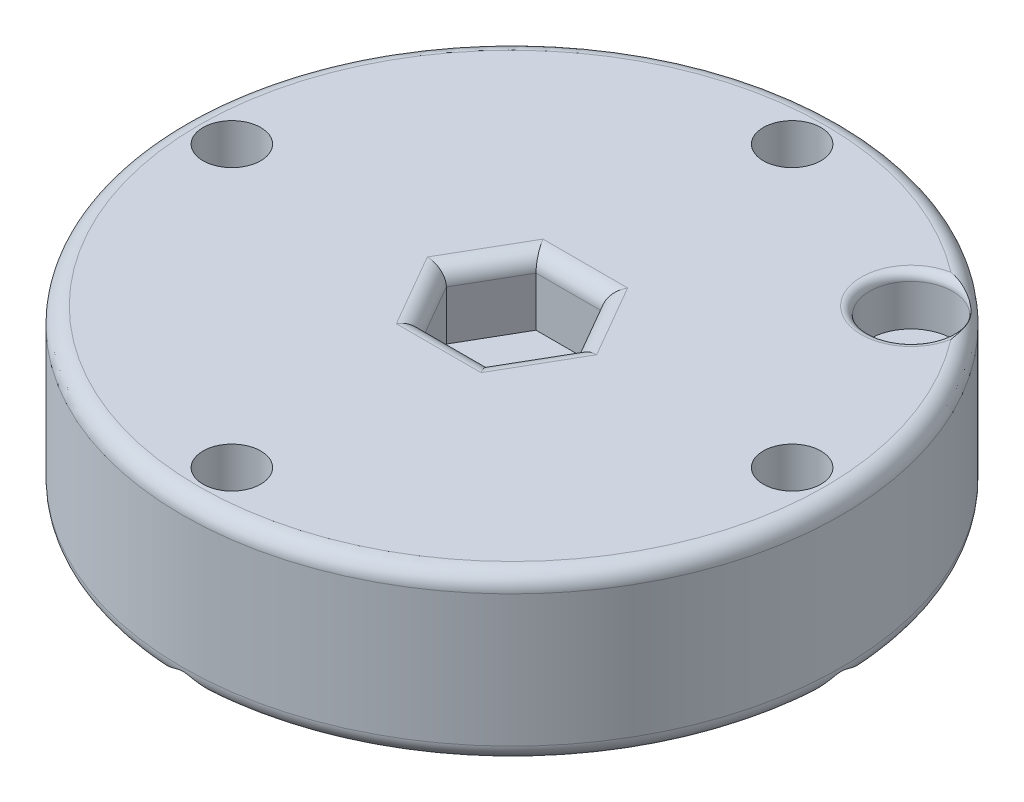
from build123d import *

# Parameters (mm, degrees)
SKETCH1_R           = 20
SKETCH1_R_2         = 1.75
BOSS_EXTRUDE1_DEPTH = 10
CUT_EXTRUDE1_DEPTH  = 4
SKETCH3_R           = 4.762509525
CUT_EXTRUDE2_DEPTH  = 4.67500635
FILLET1_R           = 1
SKETCH4_R           = 2.975
CUT_EXTRUDE3_DEPTH  = 3.5
SKETCH5_R           = 2.525
CUT_EXTRUDE4_DEPTH  = 3


with BuildPart() as part:
    # Sketch1 → Boss-Extrude1 (new body)
    with BuildSketch(Plane(origin=(0, 0, 0), x_dir=(1, 0, 0), z_dir=(0, 1, 0))):
        with Locations(Location((0, 0, 0), (0, 0, 270))):
            Circle(SKETCH1_R)
        with Locations(Location((17, 0, 0), (0, 0, 270))):
            Circle(SKETCH1_R_2, mode=Mode.SUBTRACT)
        with Locations(Location((0, -17, 0), (0, 0, 270))):
            Circle(SKETCH1_R_2, mode=Mode.SUBTRACT)
        with Locations(Location((-17, 0, 0), (0, 0, 270))):
            Circle(SKETCH1_R_2, mode=Mode.SUBTRACT)
        with Locations(Location((0, 17, 0), (0, 0, 270))):
            Circle(SKETCH1_R_2, mode=Mode.SUBTRACT)
    extrude(amount=BOSS_EXTRUDE1_DEPTH)

    # Sketch2 → Cut-Extrude1 (cut)
    with BuildSketch(Plane(origin=(0, 10, 0), x_dir=(1, 0, 0), z_dir=(0, 1, 0))):
        Polygon((3.983716857, 0), (1.991858429, 3.45), (-1.991858429, 3.45), (-3.983716857, 0), (-1.991858429, -3.45), (1.991858429, -3.45), align=None)
    extrude(amount=-CUT_EXTRUDE1_DEPTH, mode=Mode.SUBTRACT)

    # Sketch3 → Cut-Extrude2 (cut)
    with BuildSketch(Plane.XZ):
        with Locations(Location((0, 0, 0), (0, 0, 270))):
            Circle(SKETCH3_R)
    extrude(amount=-CUT_EXTRUDE2_DEPTH, mode=Mode.SUBTRACT)

    # Fillet1
    fillet1_edges = [part.edges().sort_by_distance(p)[0] for p in [
        (0, 0, -20),
        (2.987787643, 10, 1.725),
        (2.987787643, 10, -1.725),
        (0, 10, -3.45),
        (-2.987787643, 10, -1.725),
        (-2.987787643, 10, 1.725),
        (0, 10, 3.45),
        (0, 0, 4.762509525),
        (0, 10, -20),
    ]]
    fillet(fillet1_edges, radius=FILLET1_R)

    # Sketch4 → Cut-Extrude3 (cut)
    with BuildSketch(Plane.XZ):
        with Locations(Location((-17, 0, 0), (0, 0, 270))):
            Circle(SKETCH4_R)
        with Locations(Location((0, 17, 0), (0, 0, 270))):
            Circle(SKETCH4_R)
        with Locations(Location((17, 0, 0), (0, 0, 270))):
            Circle(SKETCH4_R)
        with Locations(Location((0, -17, 0), (0, 0, 270))):
            Circle(SKETCH4_R)
    extrude(amount=-CUT_EXTRUDE3_DEPTH, mode=Mode.SUBTRACT)

    # Sketch5 → Cut-Extrude4 (cut)
    with BuildSketch(Plane(origin=(0, 10, 0), x_dir=(1, 0, 0), z_dir=(0, 1, 0))):
        with Locations(Location((12.109203628, 12.109203628, 0), (0, 0, 270))):
            Circle(SKETCH5_R)
    extrude(amount=-CUT_EXTRUDE4_DEPTH, mode=Mode.SUBTRACT)

    # Fillet2: read off the stored shape, not the designer's step
    # Fillet2 outline → Fillet2 (revolve, cut)
    with BuildSketch(Plane(origin=(12.109203628, 0, -12.109203628), x_dir=(1, 0, 0), z_dir=(0, 0, 1))):
        with BuildLine():
            ThreePointArc((2.525, 9.5), (2.671446609, 9.853553391), (3.025, 10))
            Line((3.025, 10), (2.525, 10))
            Line((2.525, 10), (2.525, 9.5))
        make_face()
    revolve(axis=Axis((12.109203628, 0, -12.109203628), (0, 1, 0)), mode=Mode.SUBTRACT)


solid = part.part
